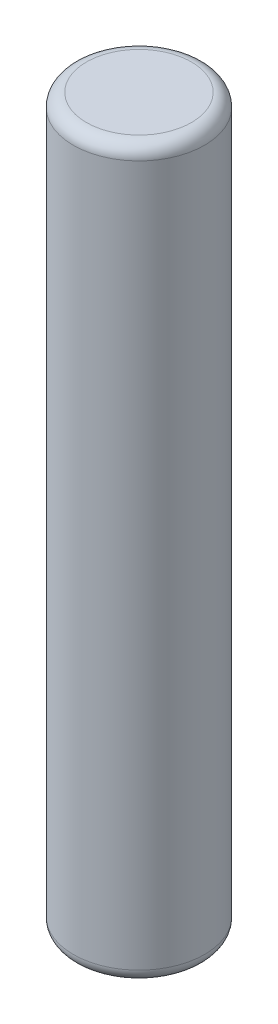
from build123d import *

# Parameters (mm, degrees)
SKETCH1_R           = 2.5
BOSS_EXTRUDE1_DEPTH = 27.7
FILLET1_R           = 0.5


with BuildPart() as part:
    # Sketch1 → Boss-Extrude1 (new body)
    with BuildSketch(Plane(origin=(0, 0, 0), x_dir=(1, 0, 0), z_dir=(0, 1, 0))):
        Circle(SKETCH1_R)
    extrude(amount=BOSS_EXTRUDE1_DEPTH)

    # Fillet1
    fillet1_edges = [part.edges().sort_by_distance(p)[0] for p in [
        (-2.5, 0, 0),
        (-2.5, 27.7, 0),
    ]]
    fillet(fillet1_edges, radius=FILLET1_R)


solid = part.part
